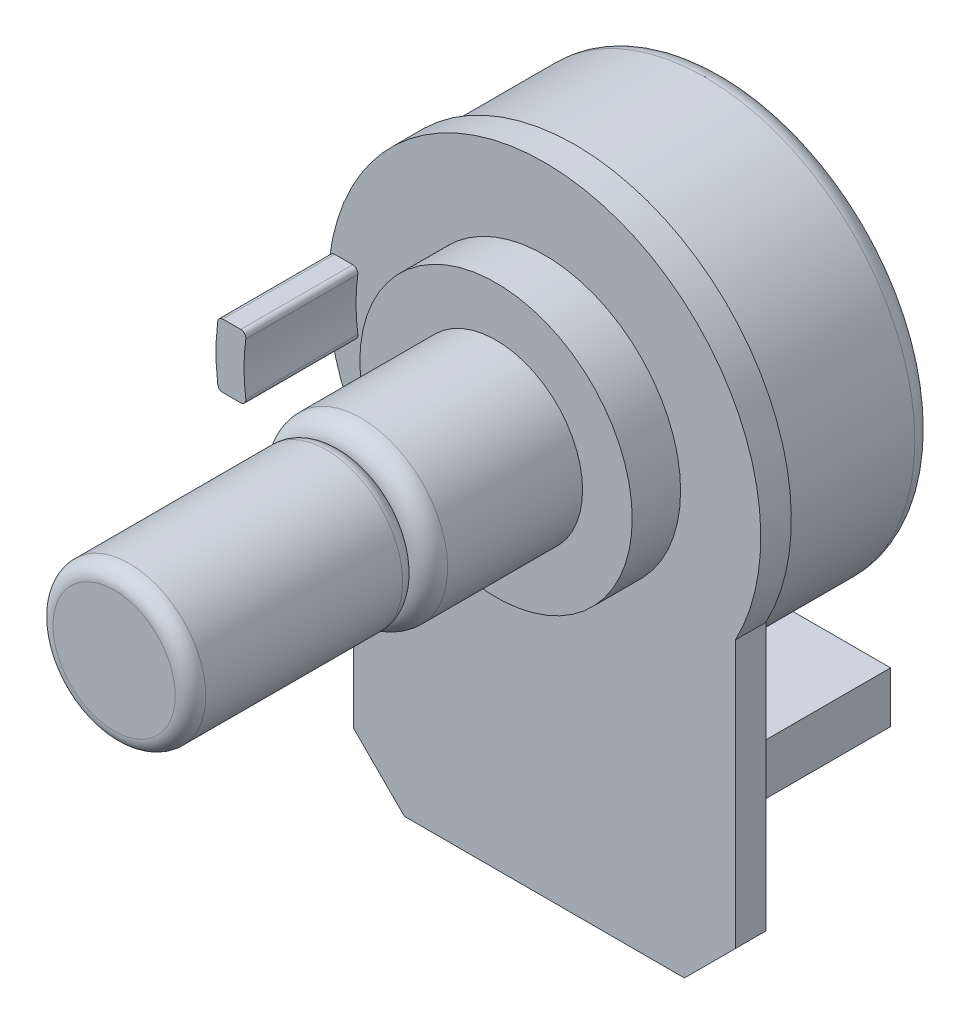
from build123d import *

# Parameters (mm, degrees)
BOSS_EXTRUDE1_DEPTH = 1.2
SKETCH2_R           = 5.35
BOSS_EXTRUDE2_DEPTH = 1.9
SKETCH3_R           = 3.4
BOSS_EXTRUDE3_DEPTH = 6.1
FILLET2_R           = 0.8
SKETCH4_R           = 3
BOSS_EXTRUDE4_DEPTH = 8.9
SKETCH5_R           = 8.25
BOSS_EXTRUDE5_DEPTH = 5.9
FILLET1_R           = 0.8
SKETCH6_W           = 12.99598454
SKETCH6_H           = 2
BOSS_EXTRUDE6_DEPTH = 5.9
FILLET3_R           = 0.6
CHAMFER1_SIZE       = 2
BOSS_EXTRUDE7_DEPTH = 4.4
FILLET4_R           = 0.2


with BuildPart() as part:
    # Sketch1 → Boss-Extrude1 (new body)
    with BuildSketch(Plane.XY):
        with BuildLine():
            Line((7.5, -4), (7.5, -16.5))
            Line((7.5, -16.5), (-7.5, -16.5))
            Line((-7.5, -16.5), (-7.5, -4))
            ThreePointArc((-7.5, -4), (0, 8.5), (7.5, -4))
        make_face()
    extrude(amount=BOSS_EXTRUDE1_DEPTH)

    # Sketch2 → Boss-Extrude2 (add)
    with BuildSketch(Plane.XY.offset(1.2)):
        with Locations(Location((0, 0, 0), (0, 0, 180))):
            Circle(SKETCH2_R)
    extrude(amount=BOSS_EXTRUDE2_DEPTH)

    # Sketch3 → Boss-Extrude3 (add)
    with BuildSketch(Plane.XY.offset(3.1)):
        Circle(SKETCH3_R)
    extrude(amount=BOSS_EXTRUDE3_DEPTH)

    # Fillet2
    fillet2_edges = [part.edges().sort_by_distance(p)[0] for p in [
        (-3.4, 0, 9.2),
    ]]
    fillet(fillet2_edges, radius=FILLET2_R)

    # Sketch4 → Boss-Extrude4 (add)
    with BuildSketch(Plane.XY.offset(9.2)):
        Circle(SKETCH4_R)
    extrude(amount=BOSS_EXTRUDE4_DEPTH)

    # Sketch5 → Boss-Extrude5 (add)
    with BuildSketch(Plane(origin=(0, 0, 0), x_dir=(-1, 0, 0), z_dir=(0, 0, -1))):
        with Locations(Location((0, 0, 0), (0, 0, 180))):
            Circle(SKETCH5_R)
    extrude(amount=BOSS_EXTRUDE5_DEPTH)

    # Fillet1
    fillet1_edges = [part.edges().sort_by_distance(p)[0] for p in [
        (-8.25, 0, -5.9),
    ]]
    fillet(fillet1_edges, radius=FILLET1_R)

    # Sketch6 → Boss-Extrude6 (add)
    with BuildSketch(Plane(origin=(0, 0, 0), x_dir=(-1, 0, 0), z_dir=(0, 0, -1))):
        with Locations((0, -10)):
            Rectangle(SKETCH6_W, SKETCH6_H)
    extrude(amount=BOSS_EXTRUDE6_DEPTH)

    # Fillet3
    # the kernel refuses this fillet: 0.6 mm, written as the material it takes off along each edge
    with BuildSketch(Plane(origin=(0, 0, 9.2), x_dir=(1, 0, 0), z_dir=(0, -1, 0))) as fillet3_piece_1:
        with BuildLine():
            CenterArc((2.4, 0.565685425), FILLET3_R, 289.471220634, 70.528779366)
            Line((3, 0.565685425), (3, 0))
            Line((3, 0), (2.6, 0))
        make_face()
    revolve(axis=Axis((0, 0, 9.2), (0, 0, 1)), mode=Mode.SUBTRACT)
    with BuildSketch(Plane(origin=(0, 0, 18.1), x_dir=(1, 0, 0), z_dir=(0, -1, 0))) as fillet3_piece_2:
        with BuildLine():
            CenterArc((3 - FILLET3_R, -FILLET3_R), FILLET3_R, 0, 90)
            Line((3 - FILLET3_R, 0), (3, 0))
            Line((3, 0), (3, -FILLET3_R))
        make_face()
    revolve(axis=Axis((0, 0, 18.1), (0, 0, 1)), mode=Mode.SUBTRACT)

    # Chamfer1
    chamfer1_edges = [part.edges().sort_by_distance(p)[0] for p in [
        (7.5, -16.5, 0.6),
        (-7.5, -16.5, 0.6),
    ]]
    chamfer(chamfer1_edges, length=CHAMFER1_SIZE)

    # Sketch8 → Boss-Extrude7 (add)
    with BuildSketch(Plane.XY.offset(1.2)):
        with BuildLine():
            Line((-8.40758586, 1.25), (-7.293661632, 1.25))
            ThreePointArc((-7.293661632, 1.25), (-7.4, 0), (-7.293661632, -1.25))
            Line((-7.293661632, -1.25), (-8.40758586, -1.25))
            ThreePointArc((-8.40758586, -1.25), (-8.5, 0), (-8.40758586, 1.25))
        make_face()
    extrude(amount=BOSS_EXTRUDE7_DEPTH)

    # Fillet4
    fillet4_edges = [part.edges().sort_by_distance(p)[0] for p in [
        (-8.40758586, 1.25, 3.4),
        (-8.40758586, -1.25, 3.4),
        (-7.293661632, -1.25, 3.4),
        (-7.293661632, 1.25, 3.4),
    ]]
    fillet(fillet4_edges, radius=FILLET4_R)


solid = part.part
